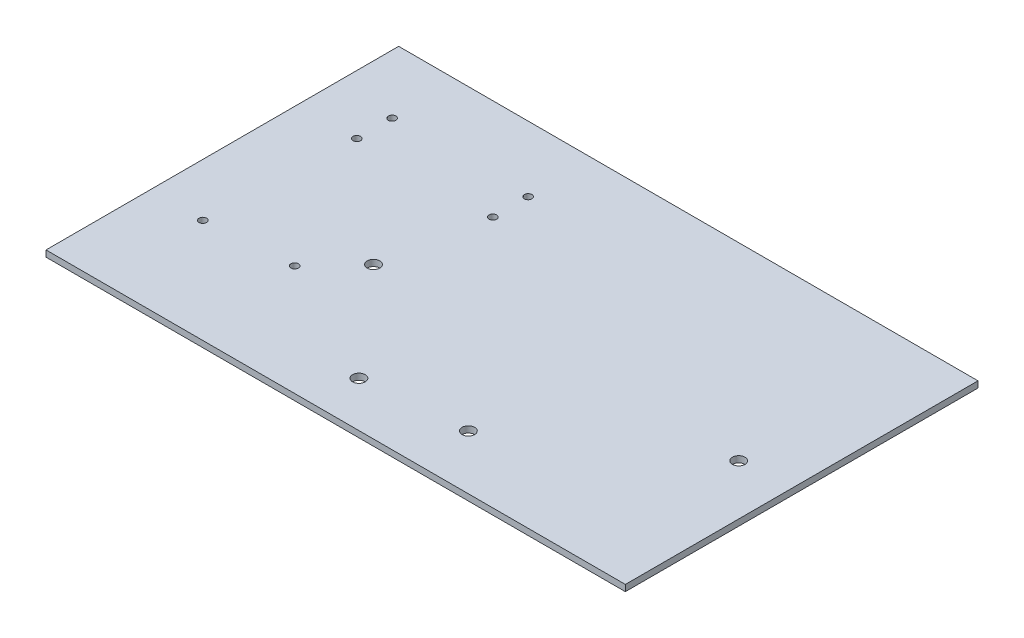
from build123d import *

# Parameters (mm, degrees)
SKETCH1_W           = 317.5
SKETCH1_H           = 177.8
SKETCH1_R           = 3.175
SKETCH1_R_2         = 1.905
BOSS_EXTRUDE1_DEPTH = 3.175
SKETCH2_R           = 1.905
CUT_EXTRUDE1_DEPTH  = 182.974869488
SKETCH3_R           = 3.175
CUT_EXTRUDE2_DEPTH  = 182.974869488
SKETCH4_W           = 25.4
SKETCH4_H           = 177.8
CUT_EXTRUDE3_DEPTH  = 182.974869488


with BuildPart() as part:
    # Sketch1 → Boss-Extrude1 (new body)
    with BuildSketch(Plane(origin=(0, 0, 0), x_dir=(1, 0, 0), z_dir=(0, 1, 0))):
        Rectangle(SKETCH1_W, SKETCH1_H)
        with Locations((-69.85, -12.7)):
            Circle(SKETCH1_R, mode=Mode.SUBTRACT)
        with Locations((107.95, -6.35)):
            Circle(SKETCH1_R, mode=Mode.SUBTRACT)
        with Locations((-129.032, 55.88)):
            Circle(SKETCH1_R_2, mode=Mode.SUBTRACT)
        with Locations((-60.452, 55.88)):
            Circle(SKETCH1_R_2, mode=Mode.SUBTRACT)
        with Locations((-129.032, 38.1)):
            Circle(SKETCH1_R_2, mode=Mode.SUBTRACT)
        with Locations((-60.452, 38.1)):
            Circle(SKETCH1_R_2, mode=Mode.SUBTRACT)
    extrude(amount=BOSS_EXTRUDE1_DEPTH)

    # Sketch2 → Cut-Extrude1 (cut, through all)
    with BuildSketch(Plane(origin=(0, 3.175, 0), x_dir=(1, 0, 0), z_dir=(0, 1, 0))):
        with Locations((-89.08170041, -33.177029855)):
            Circle(SKETCH2_R)
        with Locations((-132.137607944, -36.44830276)):
            Circle(SKETCH2_R)
    extrude(amount=-CUT_EXTRUDE1_DEPTH, mode=Mode.SUBTRACT)

    # Sketch3 → Cut-Extrude2 (cut, through all)
    with BuildSketch(Plane(origin=(0, 0, 0), x_dir=(-1, 0, 0), z_dir=(0, -1, 0))):
        with Locations((23.829539609, -66.04)):
            Circle(SKETCH3_R)
        with Locations((-26.764302072, -61.468)):
            Circle(SKETCH3_R)
    extrude(amount=-CUT_EXTRUDE2_DEPTH, mode=Mode.SUBTRACT)

    # Sketch4 → Cut-Extrude3 (cut, through all)
    with BuildSketch(Plane(origin=(0, 3.175, 0), x_dir=(1, 0, 0), z_dir=(0, 1, 0))):
        with Locations((146.05, 0)):
            Rectangle(SKETCH4_W, SKETCH4_H)
    extrude(amount=-CUT_EXTRUDE3_DEPTH, mode=Mode.SUBTRACT)


solid = part.part
